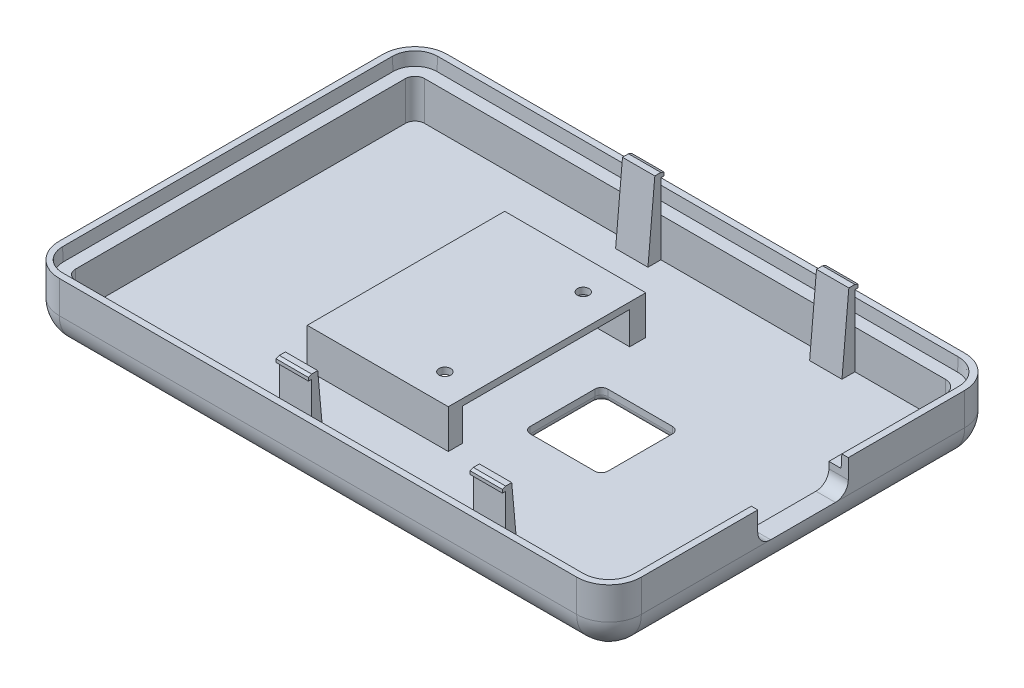
from build123d import *

# Parameters (mm, degrees)
SKETCH1_W                = 90
SKETCH1_H                = 60
BOSS_EXTRUDE1_DEPTH      = 10
SKETCH2_W                = 84
SKETCH2_H                = 54
CUT_EXTRUDE1_DEPTH       = 8
FILLET1_R                = 1.5
FILLET2_R                = 2
FILLET3_R                = 5
FILLET4_R                = 5
SKETCH3_W                = 14.7
SKETCH3_H                = 24.7
CUT_EXTRUDE2_DEPTH       = 2
SKETCH4_W                = 21.81374525
SKETCH4_H                = 30.528820574
BOSS_EXTRUDE2_DEPTH      = 6
SKETCH5_W                = 25.860829819
SKETCH5_H                = 5
CUT_EXTRUDE3_DEPTH       = 21.813745251
SKETCH7_R                = 0.9
CUT_EXTRUDE5_DEPTH       = 3
SKETCH8_R                = 0.9
CUT_EXTRUDE6_DEPTH       = 3
SKETCH13_W               = 14
SKETCH13_H               = 10
CUT_EXTRUDE8_DEPTH       = 4
SKETCH14_W               = 12
SKETCH14_H               = 12
CUT_EXTRUDE9_DEPTH       = 2
FILLET8_R                = 1
LIP_GROOVE1_GROOVE_DEPTH = 2
LIP_GROOVE1_GROOVE_DRAFT = -3
FILLET9_R                = 2
SNAP_START               = -8.979179279
SNAP_HOOK9_DEPTH         = 5
LPATTERN1_COUNT          = 2
LPATTERN1_PITCH          = 30
MIRROR1_START            = -8.979179279
MIRROR1_COPY_1_DEPTH     = 5


# Read off the part's stored shape, not the designer's step: Lip&Groove1-Groove, Snap Hook9
with BuildPart() as part:
    # Sketch1 → Boss-Extrude1 (new body)
    with BuildSketch(Plane(origin=(0, 0, 0), x_dir=(1, 0, 0), z_dir=(0, 1, 0))):
        Rectangle(SKETCH1_W, SKETCH1_H)
    extrude(amount=BOSS_EXTRUDE1_DEPTH)

    # Sketch2 → Cut-Extrude1 (cut)
    with BuildSketch(Plane(origin=(0, 10, 0), x_dir=(1, 0, 0), z_dir=(0, 1, 0))):
        Rectangle(SKETCH2_W, SKETCH2_H)
    extrude(amount=-CUT_EXTRUDE1_DEPTH, mode=Mode.SUBTRACT)

    # Fillet1
    fillet1_edges = [part.edges().sort_by_distance(p)[0] for p in [
        (-42, 6, 27),
        (-42, 6, -27),
    ]]
    fillet(fillet1_edges, radius=FILLET1_R)

    # Fillet2
    fillet2_edges = [part.edges().sort_by_distance(p)[0] for p in [
        (42, 6, -27),
        (42, 6, 27),
    ]]
    fillet(fillet2_edges, radius=FILLET2_R)

    # Fillet3
    fillet3_edges = [part.edges().sort_by_distance(p)[0] for p in [
        (0, 0, 30),
        (-45, 0, 0),
        (0, 0, -30),
        (45, 0, 0),
        (45, 5, 30),
        (45, 5, -30),
    ]]
    fillet(fillet3_edges, radius=FILLET3_R)

    # Fillet4
    # the kernel refuses this fillet: 5 mm, written as the material it takes off along each edge
    with BuildSketch(Plane(origin=(-40, 5, -25), x_dir=(-1, 0, 0), z_dir=(0, 0, -1))) as fillet4_piece_1_section:
        Polygon((0, 0), (FILLET4_R, 0), (FILLET4_R, -FILLET4_R), (0, -FILLET4_R), align=None)
    fillet4_piece_1 = extrude(amount=FILLET4_R, mode=Mode.PRIVATE)
    fillet4_piece_1 = fillet4_piece_1 - Plane(origin=(-40, 5, -25), x_dir=(0.7071067811865475, 0.7071067811865475, 0), z_dir=(0, 0, -1)) * Sphere(FILLET4_R, mode=Mode.PRIVATE)
    add(fillet4_piece_1, mode=Mode.SUBTRACT)
    with BuildSketch(Plane(origin=(-40, 5, 25), x_dir=(0, 0, 1), z_dir=(-1, 0, 0))) as fillet4_piece_2_section:
        Polygon((0, 0), (FILLET4_R, 0), (FILLET4_R, -FILLET4_R), (0, -FILLET4_R), align=None)
    fillet4_piece_2 = extrude(amount=FILLET4_R, mode=Mode.PRIVATE)
    fillet4_piece_2 = fillet4_piece_2 - Plane(origin=(-40, 5, 25), x_dir=(0, 0.7071067811865475, -0.7071067811865475), z_dir=(-1, 0, 0)) * Sphere(FILLET4_R, mode=Mode.PRIVATE)
    add(fillet4_piece_2, mode=Mode.SUBTRACT)
    with BuildSketch(Plane(origin=(-45, 5, 30), x_dir=(0, 0, -1), z_dir=(0, 1, 0)), Plane(origin=(-45, 5, -30), x_dir=(1, 0, 0), z_dir=(0, 1, 0))) as fillet4_piece_3:
        with BuildLine():
            CenterArc((FILLET4_R, -FILLET4_R), FILLET4_R, 90, 90)
            Line((0, -FILLET4_R), (0, 0))
            Line((0, 0), (FILLET4_R, 0))
        make_face()
    extrude(amount=17.5, mode=Mode.SUBTRACT)

    # Sketch3 → Cut-Extrude2 (cut)
    with BuildSketch(Plane.XZ):
        with Locations((-12.034158324, 0)):
            Rectangle(SKETCH3_W, SKETCH3_H)
    extrude(amount=-CUT_EXTRUDE2_DEPTH, mode=Mode.SUBTRACT)

    # Sketch4 → Boss-Extrude2 (add)
    with BuildSketch(Plane(origin=(0, 2, 0), x_dir=(1, 0, 0), z_dir=(0, 1, 0))):
        with Locations((-5.646185712, 0.155219816)):
            Rectangle(SKETCH4_W, SKETCH4_H)
    extrude(amount=BOSS_EXTRUDE2_DEPTH)

    # Sketch5 → Cut-Extrude3 (cut)
    with BuildSketch(Plane.ZY.offset(16.553058337)):
        with Locations((-0.004897078, 4.5)):
            Rectangle(SKETCH5_W, SKETCH5_H)
    extrude(amount=-CUT_EXTRUDE3_DEPTH, mode=Mode.SUBTRACT)

    # Sketch7 → Cut-Extrude5 (cut)
    with BuildSketch(Plane(origin=(0, 8, 0), x_dir=(1, 0, 0), z_dir=(0, 1, 0))):
        with Locations(Location((0.315841676, -10.7, 0), (0, 0, 270))):
            Circle(SKETCH7_R)
    extrude(amount=-CUT_EXTRUDE5_DEPTH, mode=Mode.SUBTRACT)

    # Sketch8 → Cut-Extrude6 (cut)
    with BuildSketch(Plane(origin=(0, 8, 0), x_dir=(1, 0, 0), z_dir=(0, 1, 0))):
        with Locations(Location((0.315841676, 10.7, 0), (0, 0, 270))):
            Circle(SKETCH8_R)
    extrude(amount=-CUT_EXTRUDE6_DEPTH, mode=Mode.SUBTRACT)

    # Sketch13 → Cut-Extrude8 (cut)
    with BuildSketch(Plane.ZY.offset(-45)):
        with Locations((0, 10)):
            Rectangle(SKETCH13_W, SKETCH13_H)
    extrude(amount=CUT_EXTRUDE8_DEPTH, mode=Mode.SUBTRACT)

    # Sketch14 → Cut-Extrude9 (cut)
    with BuildSketch(Plane.XZ):
        with Locations((14.228896708, 0.411404455)):
            Rectangle(SKETCH14_W, SKETCH14_H)
    extrude(amount=-CUT_EXTRUDE9_DEPTH, mode=Mode.SUBTRACT)

    # Fillet8
    fillet8_edges = [part.edges().sort_by_distance(p)[0] for p in [
        (8.228896708, 0, 0.411404455),
        (14.228896708, 0, -5.588595545),
        (20.228896708, 0, 0.411404455),
        (14.228896708, 0, 6.411404455),
        (20.228896708, 1, -5.588595545),
        (20.228896708, 1, 6.411404455),
        (8.228896708, 1, 6.411404455),
        (8.228896708, 1, -5.588595545),
    ]]
    fillet(fillet8_edges, radius=FILLET8_R)


with BuildPart() as lip_groove1_groove_tool:
    # Lip&Groove1-Groove outline → Lip&Groove1-Groove (with draft: the straight prism first)
    with BuildSketch(Plane(origin=(0, 8, 0), x_dir=(1, 0, 0), z_dir=(0, 1, 0))):
        with BuildLine():
            Line((43.895184441, 7), (43.895184441, 25))
            ThreePointArc((43.895184441, 25), (42.754311333, 27.754311333), (40, 28.895184441))
            Line((40, 28.895184441), (-40.5, 28.895184441))
            ThreePointArc((-40.5, 28.895184441), (-42.900757942, 27.900757942), (-43.895184441, 25.5))
            Line((-43.895184441, 25.5), (-43.895184441, -25.5))
            ThreePointArc((-43.895184441, -25.5), (-42.900757942, -27.900757942), (-40.5, -28.895184441))
            Line((-40.5, -28.895184441), (40, -28.895184441))
            ThreePointArc((40, -28.895184441), (42.754311333, -27.754311333), (43.895184441, -25))
            Line((43.895184441, -25), (43.895184441, -7))
            Line((43.895184441, -7), (42, -7))
            Line((42, -7), (42, -25))
            ThreePointArc((42, -25), (41.414213562, -26.414213562), (40, -27))
            Line((40, -27), (-40.5, -27))
            ThreePointArc((-40.5, -27), (-41.560660172, -26.560660172), (-42, -25.5))
            Line((-42, -25.5), (-42, 25.5))
            ThreePointArc((-42, 25.5), (-41.560660172, 26.560660172), (-40.5, 27))
            Line((-40.5, 27), (40, 27))
            ThreePointArc((40, 27), (41.414213562, 26.414213562), (42, 25))
            Line((42, 25), (42, 7))
            Line((42, 7), (43.895184441, 7))
        make_face()
    extrude(amount=LIP_GROOVE1_GROOVE_DEPTH)
    # Lip&Groove1-Groove: the draft: its side faces are tilted about the plane it starts from
    lip_groove1_groove_sides = [lip_groove1_groove_tool.faces().sort_by_distance(p)[0] for p in [
        (43.895184441, 9, -16),
        (42.754311333, 9, -27.754311333),
        (-0.25, 9, -28.895184441),
        (-42.900757942, 9, -27.900757942),
        (-43.895184441, 9, 0),
        (-42.900757942, 9, 27.900757942),
        (-0.25, 9, 28.895184441),
        (42.754311333, 9, 27.754311333),
        (43.895184441, 9, 16),
        (42.94759222, 9, 7),
        (42, 9, 16),
        (41.414213562, 9, 26.414213562),
        (-0.25, 9, 27),
        (-41.560660172, 9, 26.560660172),
        (-42, 9, 0),
        (-41.560660172, 9, -26.560660172),
        (-0.25, 9, -27),
        (41.414213562, 9, -26.414213562),
        (42, 9, -16),
        (42.94759222, 9, -7),
    ]]
    draft(lip_groove1_groove_sides, Plane(origin=(0, 8, 0), x_dir=(1, 0, 0), z_dir=(0, 1, 0)), LIP_GROOVE1_GROOVE_DRAFT)


with BuildPart() as part_1:
    add(part.part)

    # Lip&Groove1-Groove: cut by lip_groove1_groove_tool
    add(lip_groove1_groove_tool.part, mode=Mode.SUBTRACT)

    # Fillet9
    fillet9_edges = [part_1.edges().sort_by_distance(p)[0] for p in [
        (43.5, 5, -7),
        (43.5, 5, 7),
    ]]
    fillet(fillet9_edges, radius=FILLET9_R)

    # Snap Hook9 outline → Snap Hook9 (add)
    with BuildSketch(Plane.YZ.offset(SNAP_START)):
        Polygon((13, 27.5), (13, 27), (2, 27), (2, 25), (13.7, 26.063636364), (13.7, 27), (13.5, 27.5), align=None)
    snap_hook9 = extrude(amount=SNAP_HOOK9_DEPTH)

    # LPattern1: Snap Hook9 ×2
    with Locations(*[(i * LPATTERN1_PITCH, 0, 0) for i in range(1, LPATTERN1_COUNT)]):
        add(snap_hook9)

    # Mirror1: Snap Hook9 across plane
    add(snap_hook9.mirror(Plane.XY))

    # Mirror1 copy 1 sketch → Mirror1 copy 1 (add)
    with BuildSketch(Plane.YZ.offset(30).offset(MIRROR1_START)):
        Polygon((13, -27.5), (13, -27), (2, -27), (2, -25), (13.7, -26.063636364), (13.7, -27), (13.5, -27.5), align=None)
    extrude(amount=MIRROR1_COPY_1_DEPTH)


solid = part_1.part
